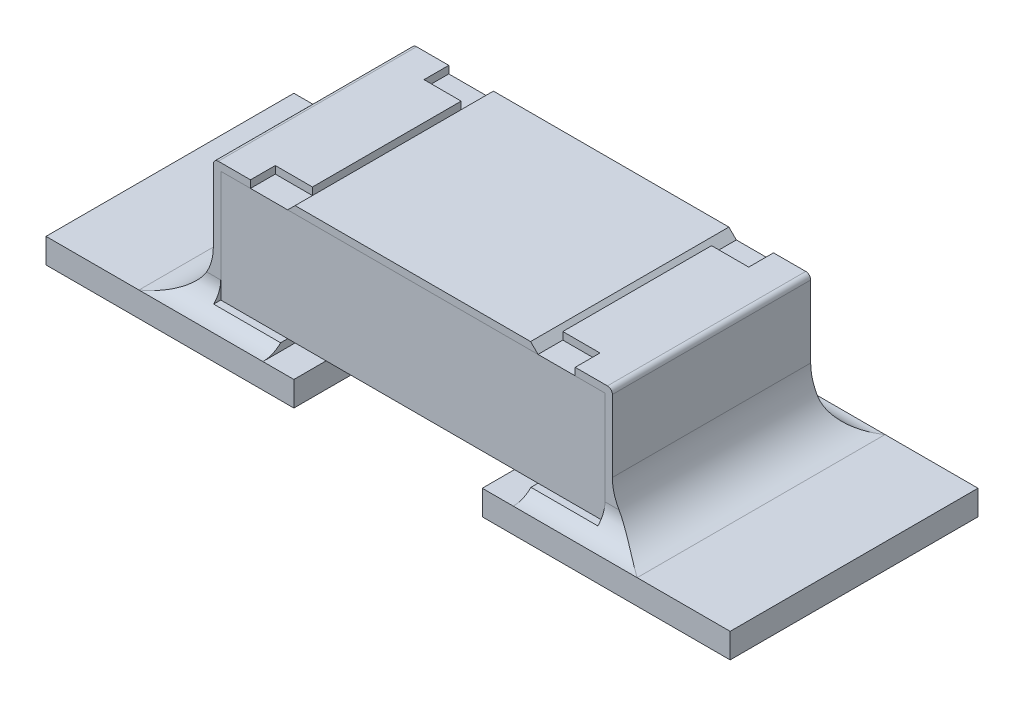
from build123d import *

# Parameters (mm, degrees)
SKETCH1_W           = 0.8
SKETCH1_H           = 0.45
BOSS_EXTRUDE1_DEPTH = 0.775
BOSS_EXTRUDE2_DEPTH = 0.4
FILLET1_R           = 0.02
SKETCH3_W           = 0.15
SKETCH3_H           = 0.1
CUT_EXTRUDE1_DEPTH  = 0.03
SKETCH6_W           = 1
SKETCH6_H           = 1
BOSS_EXTRUDE5_DEPTH = 0.1
FILLET2_R           = 0.2
FILLET3_START       = -0.862971281
FILLET3_DEPTH       = 0.087971281
FILLET3_START_2     = -0.8049999
FILLET3_2_DEPTH     = 0.2999999
FILLET3_START_3     = -1.0050001
FILLET3_3_DEPTH     = 0.142028819
FILLET3_START_4     = -2
FILLET3_4_OUTLINE_W = 0.27
FILLET3_4_OUTLINE_H = 0.07
FILLET3_4_DEPTH     = 3
BOSS_EXTRUDE6_DEPTH = 0.8


with BuildPart() as part:
    # Sketch1 → Boss-Extrude1 (new, symmetric)
    with BuildSketch(Plane(origin=(0, 0, 0), x_dir=(0, 0, -1), z_dir=(1, 0, 0))):
        with Locations((0, 0.355)):
            Rectangle(SKETCH1_W, SKETCH1_H)
    extrude(amount=BOSS_EXTRUDE1_DEPTH, both=True)


with BuildPart() as body_2:
    # Sketch2 → Boss-Extrude2 (new, symmetric)
    with BuildSketch(Plane.XY):
        Polygon((-0.505, 0.58), (-0.775, 0.58), (-0.775, 0.13), (-0.505, 0.13), (-0.505, 0.1), (-0.805, 0.1), (-0.805, 0.61), (-0.505, 0.61), align=None)
    extrude(amount=BOSS_EXTRUDE2_DEPTH, both=True)

    # Fillet1
    fillet1_edges = [body_2.edges().sort_by_distance(p)[0] for p in [
        (-0.805, 0.61, 0),
    ]]
    fillet(fillet1_edges, radius=FILLET1_R)

    # Sketch3 → Cut-Extrude1 (cut)
    with BuildSketch(Plane(origin=(0, 0.61, 0), x_dir=(1, 0, 0), z_dir=(0, 1, 0))):
        with Locations((-0.58, 0.35)):
            Rectangle(SKETCH3_W, SKETCH3_H)
        with Locations((-0.58, -0.35)):
            Rectangle(SKETCH3_W, SKETCH3_H)
    extrude(amount=-CUT_EXTRUDE1_DEPTH, mode=Mode.SUBTRACT)

    # Sketch6 → Boss-Extrude5 (add)
    with BuildSketch(Plane.XZ.offset(-0.1)):
        with Locations((-0.88, 0)):
            Rectangle(SKETCH6_W, SKETCH6_H)
    extrude(amount=BOSS_EXTRUDE5_DEPTH)

    # Fillet2
    fillet2_edges = [body_2.edges().sort_by_distance(p)[0] for p in [
        (-0.805, 0.1, 0),
    ]]
    fillet(fillet2_edges, radius=FILLET2_R)

    # Fillet3: read off the stored shape, not the designer's step
    # Fillet3 outline → Fillet3 (add)
    with BuildSketch(Plane.YZ.offset(FILLET3_START)):
        with BuildLine():
            Line((0.1, 0.5), (0.1, 0.4))
            Line((0.1, 0.4), (0.2, 0.4))
            ThreePointArc((0.2, 0.4), (0.129289322, 0.429289322), (0.1, 0.5))
        make_face()
        with BuildLine():
            ThreePointArc((0.1, -0.5), (0.129289322, -0.429289322), (0.2, -0.4))
            Line((0.2, -0.4), (0.1, -0.4))
            Line((0.1, -0.4), (0.1, -0.5))
        make_face()
    extrude(amount=FILLET3_DEPTH)

    # Fillet3 2 outline → Fillet3 2 (add)
    with BuildSketch(Plane.YZ.offset(FILLET3_START_2)):
        with BuildLine():
            Line((0.1, 0.5), (0.1, 0.4))
            Line((0.1, 0.4), (0.2, 0.4))
            ThreePointArc((0.2, 0.4), (0.129289322, 0.429289322), (0.1, 0.5))
        make_face()
        with BuildLine():
            ThreePointArc((0.1, -0.5), (0.129289322, -0.429289322), (0.2, -0.4))
            Line((0.2, -0.4), (0.1, -0.4))
            Line((0.1, -0.4), (0.1, -0.5))
        make_face()
    extrude(amount=FILLET3_2_DEPTH)

    # Fillet3 3 outline → Fillet3 3 (add)
    with BuildSketch(Plane.YZ.offset(FILLET3_START_3)):
        with BuildLine():
            Line((0.1, 0.5), (0.1, 0.4))
            Line((0.1, 0.4), (0.2, 0.4))
            ThreePointArc((0.2, 0.4), (0.129289322, 0.429289322), (0.1, 0.5))
        make_face()
        with BuildLine():
            ThreePointArc((0.1, -0.5), (0.129289322, -0.429289322), (0.2, -0.4))
            Line((0.2, -0.4), (0.1, -0.4))
            Line((0.1, -0.4), (0.1, -0.5))
        make_face()
    extrude(amount=FILLET3_3_DEPTH)

    # Fillet3 4 outline → Fillet3 4 (cut)
    with BuildSketch(Plane.XY.offset(FILLET3_START_4)):
        with BuildLine():
            Line((-1.0050001, 0.2), (-1.00500005, 0.1))
            ThreePointArc((-1.00500005, 0.1), (-0.905000022, 0.126794907), (-0.831794919, 0.2))
            Line((-0.831794919, 0.2), (-1.0050001, 0.2))
        make_face()
        with Locations((-0.64, 0.165)):
            Rectangle(FILLET3_4_OUTLINE_W, FILLET3_4_OUTLINE_H)
    extrude(amount=FILLET3_4_DEPTH, mode=Mode.SUBTRACT)


with BuildPart() as body_3:
    # Mirror2: mirrored copy
    add(body_2.part.mirror(Plane(origin=(0, 0, 0), x_dir=(0, 0, 1), z_dir=(1, 0, 0))))


with BuildPart() as body_4:
    # Sketch7 → Boss-Extrude6 (new body)
    with BuildSketch(Plane.XY.offset(0.4)):
        Polygon((-0.505, 0.58), (0.505, 0.58), (0.475, 0.61), (-0.475, 0.61), align=None)
    extrude(amount=-BOSS_EXTRUDE6_DEPTH)


solid = Compound([part.part, body_2.part, body_3.part, body_4.part])
